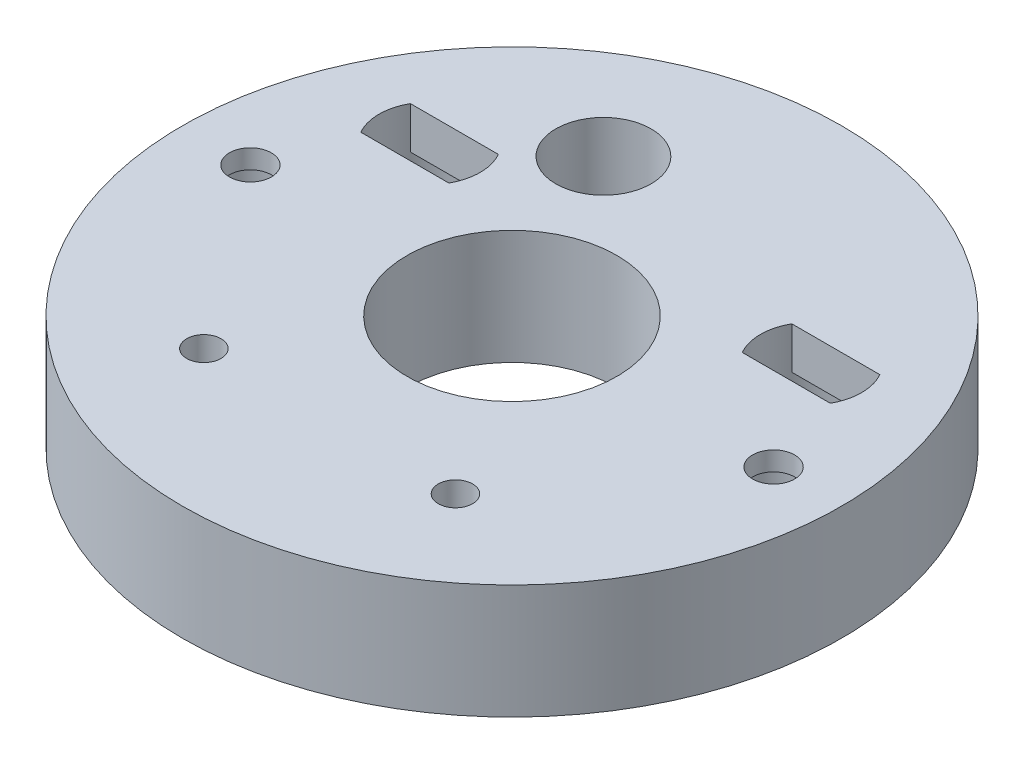
from build123d import *

# Parameters (mm, degrees)
SKETCH_1_R          = 17.28
SKETCH_1_R_2        = 5.5
SKETCH_1_R_3        = 2.65
SKETCH_1_R_4        = 1.9
EXTRUDE_1_DEPTH     = 3.8
SKETCH_2_R          = 2.5
CUT_EXTRUDE_1_DEPTH = 25.731291919
SKETCH_3_R          = 17.28
SKETCH_3_R_2        = 5.5
SKETCH_3_R_3        = 2.5
SKETCH_3_R_4        = 0.9
EXTRUDE_2_DEPTH     = 2.2
SKETCH_4_R          = 1.1
CUT_EXTRUDE_2_DEPTH = 26.163401996
SKETCH_5_R          = 1.7
CUT_EXTRUDE_3_DEPTH = 5


with BuildPart() as part:
    # 草图1 → 凸台-拉伸1 (new body)
    with BuildSketch(Plane(origin=(0, 0, 0), x_dir=(1, 0, 0), z_dir=(0, 1, 0))):
        Circle(SKETCH_1_R)
        Circle(SKETCH_1_R_2, mode=Mode.SUBTRACT)
        with Locations((-10, 5.678908346)):
            Circle(SKETCH_1_R_3, mode=Mode.SUBTRACT)
        with Locations((-6.595, -9.561091654)):
            Circle(SKETCH_1_R_4, mode=Mode.SUBTRACT)
        with Locations((6.595, -9.561091654)):
            Circle(SKETCH_1_R_4, mode=Mode.SUBTRACT)
        with Locations((10, 5.678908346)):
            Circle(SKETCH_1_R_3, mode=Mode.SUBTRACT)
    extrude(amount=EXTRUDE_1_DEPTH)

    # 草图2 → 切除-拉伸1 (cut, through all)
    with BuildSketch(Plane(origin=(0, 3.8, 0), x_dir=(1, 0, 0), z_dir=(0, 1, 0))):
        with Locations((-4.85, 9.644699566)):
            Circle(SKETCH_2_R)
    extrude(amount=-CUT_EXTRUDE_1_DEPTH, mode=Mode.SUBTRACT)

    # 草图3 → 凸台-拉伸2 (add)
    with BuildSketch(Plane(origin=(0, 3.8, 0), x_dir=(1, 0, 0), z_dir=(0, 1, 0))):
        Circle(SKETCH_3_R)
        Circle(SKETCH_3_R_2, mode=Mode.SUBTRACT)
        with Locations((-4.85, 9.644699566)):
            Circle(SKETCH_3_R_3, mode=Mode.SUBTRACT)
        with Locations((-6.595, -9.561091654)):
            Circle(SKETCH_3_R_4, mode=Mode.SUBTRACT)
        with Locations((6.595, -9.561091654)):
            Circle(SKETCH_3_R_4, mode=Mode.SUBTRACT)
        with BuildLine():
            Line((-12.309220648, 4.378908346), (-7.690779352, 4.378908346))
            ThreePointArc((-7.690779352, 4.378908346), (-7.35, 5.678908346), (-7.690779352, 6.978908346))
            Line((-7.690779352, 6.978908346), (-12.309220648, 6.978908346))
            ThreePointArc((-12.309220648, 6.978908346), (-12.65, 5.678908346), (-12.309220648, 4.378908346))
        make_face(mode=Mode.SUBTRACT)
        with BuildLine():
            Line((12.309220648, 4.378908346), (7.690779352, 4.378908346))
            ThreePointArc((7.690779352, 4.378908346), (7.35, 5.678908346), (7.690779352, 6.978908346))
            Line((7.690779352, 6.978908346), (12.309220648, 6.978908346))
            ThreePointArc((12.309220648, 6.978908346), (12.65, 5.678908346), (12.309220648, 4.378908346))
        make_face(mode=Mode.SUBTRACT)
    extrude(amount=EXTRUDE_2_DEPTH)

    # 草图4 → 切除-拉伸2 (cut, through all)
    with BuildSketch(Plane(origin=(0, 6, 0), x_dir=(1, 0, 0), z_dir=(0, 1, 0))):
        with Locations((-13.717, 0)):
            Circle(SKETCH_4_R)
        with Locations((13.717, 0)):
            Circle(SKETCH_4_R)
    extrude(amount=-CUT_EXTRUDE_2_DEPTH, mode=Mode.SUBTRACT)

    # 草图5 → 切除-拉伸3 (cut)
    with BuildSketch(Plane.XZ):
        with Locations((13.717, 0)):
            Circle(SKETCH_5_R)
        with Locations((-13.717, 0)):
            Circle(SKETCH_5_R)
    extrude(amount=-CUT_EXTRUDE_3_DEPTH, mode=Mode.SUBTRACT)


solid = part.part
